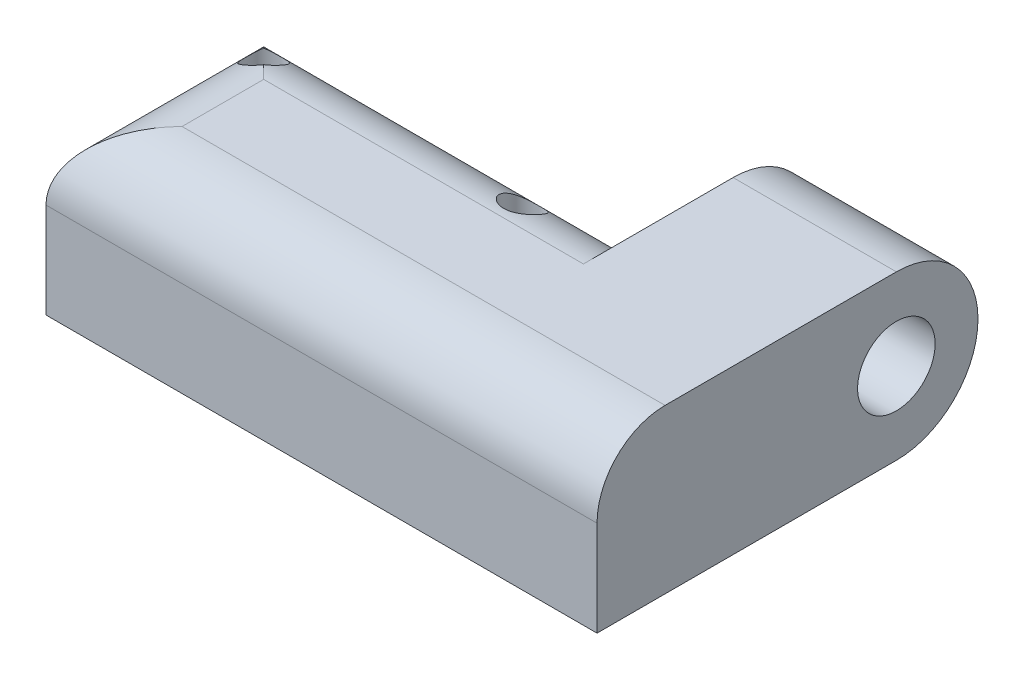
from build123d import *

# Parameters (mm, degrees)
SKETCH1_W           = 40.5
SKETCH1_H           = 16
SKETCH1_R           = 1.35
BOSS_EXTRUDE1_DEPTH = 12
BOSS_EXTRUDE2_START = 2
BOSS_EXTRUDE2_DEPTH = 10
SKETCH3_R           = 2.85
BOSS_EXTRUDE3_DEPTH = 12
FILLET2_R           = 5


with BuildPart() as part:
    # Sketch1 → Boss-Extrude1 (new body)
    with BuildSketch(Plane(origin=(0, 0, 0), x_dir=(1, 0, 0), z_dir=(0, 1, 0))):
        Rectangle(SKETCH1_W, SKETCH1_H)
        with Locations(Location((-17.25, 5, 0), (0, 0, 270))):
            Circle(SKETCH1_R, mode=Mode.SUBTRACT)
        with BuildLine():
            Line((-14.421572875, 6), (-1.078427125, 6))
            ThreePointArc((-1.078427125, 6), (1.75, 2), (4.578427125, 6))
            Line((4.578427125, 6), (18.25, 6))
            Line((18.25, 6), (18.25, -6))
            Line((18.25, -6), (-18.25, -6))
            Line((-18.25, -6), (-18.25, 2.171572875))
            ThreePointArc((-18.25, 2.171572875), (-15.128679656, 2.878679656), (-14.421572875, 6))
        make_face(mode=Mode.SUBTRACT)
        with Locations(Location((1.75, 5, 0), (0, 0, 270))):
            Circle(SKETCH1_R, mode=Mode.SUBTRACT)
    extrude(amount=BOSS_EXTRUDE1_DEPTH)

    # Sketch1<3> → Boss-Extrude2 (add)
    with BuildSketch(Plane(origin=(0, 0, 0), x_dir=(1, 0, 0), z_dir=(0, 1, 0)).offset(BOSS_EXTRUDE2_START)):
        with BuildLine():
            ThreePointArc((-14.25, 5), (-15.517949192, 2.550510257), (-18.25, 2.171572875))
            Line((-18.25, 2.171572875), (-18.25, -6))
            Line((-18.25, -6), (18.25, -6))
            Line((18.25, -6), (18.25, 6))
            Line((18.25, 6), (4.578427125, 6))
            ThreePointArc((4.578427125, 6), (4.706795679, 5.507305936), (4.75, 5))
            ThreePointArc((4.75, 5), (1.242694064, 2.043204321), (-1.078427125, 6))
            Line((-1.078427125, 6), (-14.421572875, 6))
            ThreePointArc((-14.421572875, 6), (-14.293204321, 5.507305936), (-14.25, 5))
        make_face()
    extrude(amount=BOSS_EXTRUDE2_DEPTH)

    # Sketch3 → Boss-Extrude3 (add)
    with BuildSketch(Plane(origin=(20.25, 0, 0), x_dir=(0, 0, -1), z_dir=(1, 0, 0))):
        with BuildLine():
            ThreePointArc((13.999999499, 12.000000501), (20.00000025, 6.000000501), (14, 0))
            Line((14, 0), (8, 0))
            Line((8, 0), (8, 12))
            Line((8, 12), (13.999999499, 12.000000501))
        make_face()
        with Locations((14, 6.000000501)):
            Circle(SKETCH3_R, mode=Mode.SUBTRACT)
    extrude(amount=-BOSS_EXTRUDE3_DEPTH)

    # Fillet2
    # the kernel refuses this fillet: 5 mm, written as the material it takes off along each edge
    with BuildSketch(Plane(origin=(-20.25, 12, -20.5), x_dir=(1, 0, 0), z_dir=(0, 0, 1))) as fillet2_piece_1:
        with BuildLine():
            CenterArc((FILLET2_R, -FILLET2_R), FILLET2_R, 90, 90)
            Line((0, -FILLET2_R), (0, 0))
            Line((0, 0), (FILLET2_R, 0))
        make_face()
    extrude(amount=41, mode=Mode.SUBTRACT)
    with BuildSketch(Plane(origin=(8.25, 12, -8), x_dir=(0, -1, 0), z_dir=(-1, 0, 0))) as fillet2_piece_2:
        with BuildLine():
            CenterArc((FILLET2_R, FILLET2_R), FILLET2_R, 180, 90)
            Line((0, FILLET2_R), (0, 0))
            Line((0, 0), (FILLET2_R, 0))
        make_face()
    extrude(amount=41, mode=Mode.SUBTRACT)
    with BuildSketch(Plane(origin=(-32.75, 12, 8), x_dir=(0, -1, 0), z_dir=(1, 0, 0))) as fillet2_piece_3:
        with BuildLine():
            CenterArc((FILLET2_R, FILLET2_R), FILLET2_R, 180, 90)
            Line((0, FILLET2_R), (0, 0))
            Line((0, 0), (FILLET2_R, 0))
        make_face()
    extrude(amount=65.5, mode=Mode.SUBTRACT)


solid = part.part
